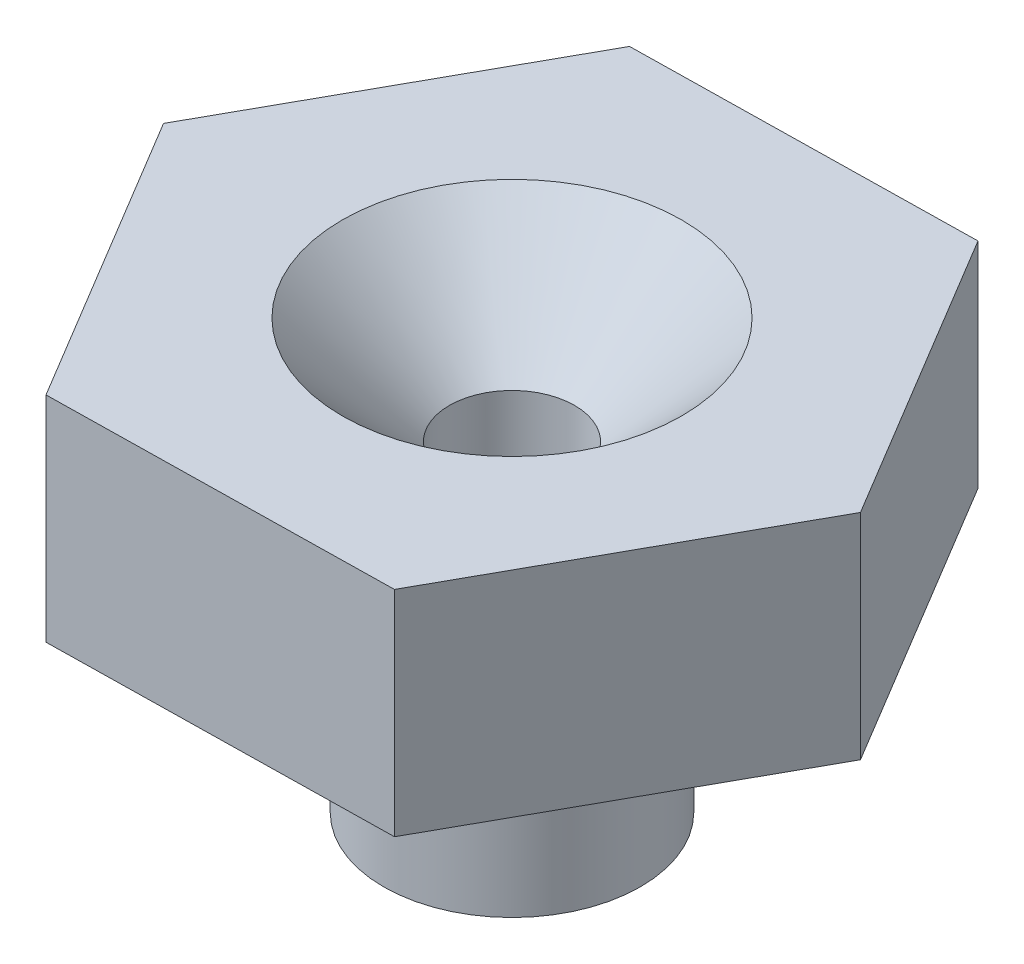
from build123d import *

# Parameters (mm, degrees)
BOSS_EXTRUDE1_DEPTH = 10
SKETCH2_R           = 6
BOSS_EXTRUDE2_DEPTH = 10
SKETCH3_R           = 2.925
CUT_EXTRUDE1_DEPTH  = 30.182746624
FILLET1_R           = 4
CHAMFER1_SIZE       = 5


with BuildPart() as part:
    # Sketch1 → Boss-Extrude1 (new body)
    with BuildSketch(Plane(origin=(0, 0, 0), x_dir=(1, 0, 0), z_dir=(0, 1, 0))):
        Polygon((-8.232776727, 13.719379992), (-15.997719961, -0.270103793), (-7.764943234, -13.989483785), (8.232776727, -13.719379992), (15.997719961, 0.270103793), (7.764943234, 13.989483785), align=None)
    extrude(amount=BOSS_EXTRUDE1_DEPTH)

    # Sketch2 → Boss-Extrude2 (add)
    with BuildSketch(Plane.XZ):
        Circle(SKETCH2_R)
    extrude(amount=BOSS_EXTRUDE2_DEPTH)

    # Sketch3 → Cut-Extrude1 (cut, through all)
    with BuildSketch(Plane.XZ.offset(10)):
        Circle(SKETCH3_R)
    extrude(amount=-CUT_EXTRUDE1_DEPTH, mode=Mode.SUBTRACT)

    # Fillet1
    fillet1_edges = [part.edges().sort_by_distance(p)[0] for p in [
        (-6, 0, 0),
    ]]
    fillet(fillet1_edges, radius=FILLET1_R)

    # Chamfer1
    chamfer1_edges = [part.edges().sort_by_distance(p)[0] for p in [
        (-2.925, 10, 0),
    ]]
    chamfer(chamfer1_edges, length=CHAMFER1_SIZE)


solid = part.part
